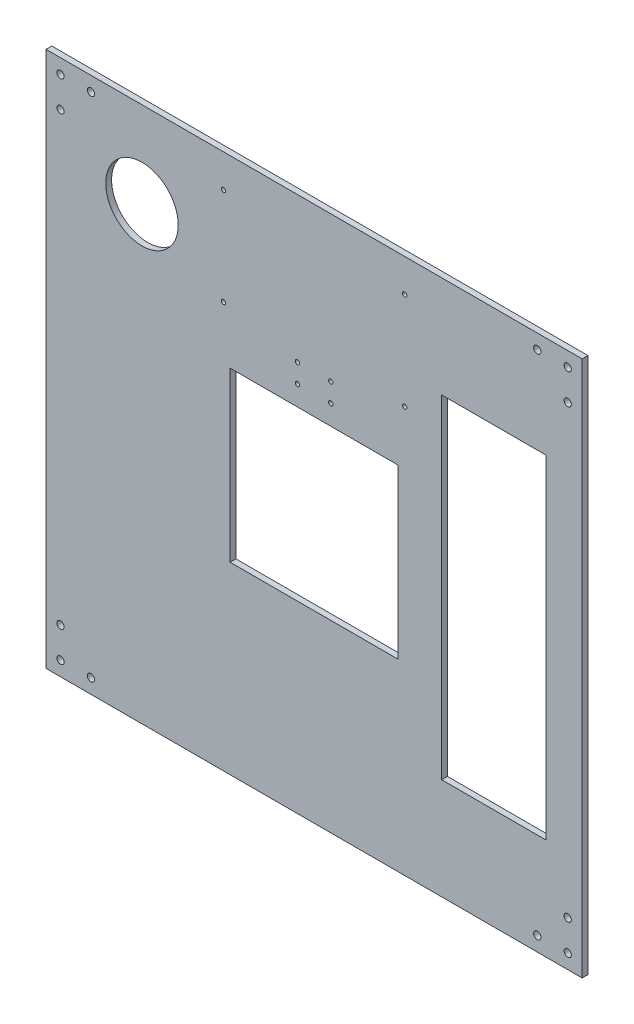
from build123d import *

# Parameters (mm, degrees)
SKETCH_1_W           = 370
SKETCH_1_H           = 370
EXTRUDE_1_DEPTH      = 4
SKETCH_2_R           = 2.5
CUT_EXTRUDE_1_DEPTH  = 262.660084843
SKETCH_6_R           = 1.5
CUT_EXTRUDE_7_DEPTH  = 262.660084843
SKETCH_7_R           = 25
CUT_EXTRUDE_8_DEPTH  = 262.660084843
SKETCH_8_W           = 116
SKETCH_8_H           = 116
CUT_EXTRUDE_9_DEPTH  = 10
SKETCH_11_W          = 72
SKETCH_11_H          = 230
CUT_EXTRUDE_11_DEPTH = 5
SKETCH_12_R          = 1.5
CUT_EXTRUDE_12_DEPTH = 262.660084843


with BuildPart() as part:
    # 草图1 → 凸台-拉伸1 (new body)
    with BuildSketch(Plane.XY):
        Rectangle(SKETCH_1_W, SKETCH_1_H)
    extrude(amount=EXTRUDE_1_DEPTH)

    # 草图2 → 切除-拉伸1 (cut, through all)
    with BuildSketch(Plane.XY.offset(4)):
        with Locations((-175, -175)):
            Circle(SKETCH_2_R)
        with Locations((-154, -175)):
            Circle(SKETCH_2_R)
        with Locations((-175, -154)):
            Circle(SKETCH_2_R)
        with Locations((-154, 175)):
            Circle(SKETCH_2_R)
        with Locations((-175, 154)):
            Circle(SKETCH_2_R)
        with Locations((-175, 175)):
            Circle(SKETCH_2_R)
        with Locations((175, 154)):
            Circle(SKETCH_2_R)
        with Locations((154, 175)):
            Circle(SKETCH_2_R)
        with Locations((175, 175)):
            Circle(SKETCH_2_R)
        with Locations((154, -175)):
            Circle(SKETCH_2_R)
        with Locations((175, -154)):
            Circle(SKETCH_2_R)
        with Locations((175, -175)):
            Circle(SKETCH_2_R)
    extrude(amount=-CUT_EXTRUDE_1_DEPTH, mode=Mode.SUBTRACT)

    # 草图6 → 切除-拉伸7 (cut, through all)
    with BuildSketch(Plane(origin=(0, 0, 0), x_dir=(-1, 0, 0), z_dir=(0, 0, -1))):
        with Locations((-62.5, 162.249795252)):
            Circle(SKETCH_6_R)
        with Locations((-62.5, 95.249795252)):
            Circle(SKETCH_6_R)
        with Locations((62.5, 95.249795252)):
            Circle(SKETCH_6_R)
        with Locations((62.5, 162.249795252)):
            Circle(SKETCH_6_R)
    extrude(amount=-CUT_EXTRUDE_7_DEPTH, mode=Mode.SUBTRACT)

    # 草图7 → 切除-拉伸8 (cut, through all)
    with BuildSketch(Plane(origin=(0, 0, 0), x_dir=(-1, 0, 0), z_dir=(0, 0, -1))):
        with Locations((118.769854949, 125.631801741)):
            Circle(SKETCH_7_R)
    extrude(amount=-CUT_EXTRUDE_8_DEPTH, mode=Mode.SUBTRACT)

    # 草图8 → 切除-拉伸9 (cut)
    with BuildSketch(Plane(origin=(0, 0, 0), x_dir=(-1, 0, 0), z_dir=(0, 0, -1))):
        Rectangle(SKETCH_8_W, SKETCH_8_H)
    extrude(amount=-CUT_EXTRUDE_9_DEPTH, mode=Mode.SUBTRACT)

    # 草图11 → 切除-拉伸11 (cut)
    with BuildSketch(Plane(origin=(0, 0, 0), x_dir=(-1, 0, 0), z_dir=(0, 0, -1))):
        with Locations((-124, 0)):
            Rectangle(SKETCH_11_W, SKETCH_11_H)
    extrude(amount=-CUT_EXTRUDE_11_DEPTH, mode=Mode.SUBTRACT)

    # 草图12 → 切除-拉伸12 (cut, through all)
    with BuildSketch(Plane(origin=(0, 0, 0), x_dir=(-1, 0, 0), z_dir=(0, 0, -1))):
        with Locations((-11.5, 71.732050808)):
            Circle(SKETCH_12_R)
        with Locations((11.5, 71.732050808)):
            Circle(SKETCH_12_R)
        with Locations((-11.5, 84.732050808)):
            Circle(SKETCH_12_R)
        with Locations((11.5, 84.732050808)):
            Circle(SKETCH_12_R)
    extrude(amount=-CUT_EXTRUDE_12_DEPTH, mode=Mode.SUBTRACT)


solid = part.part
